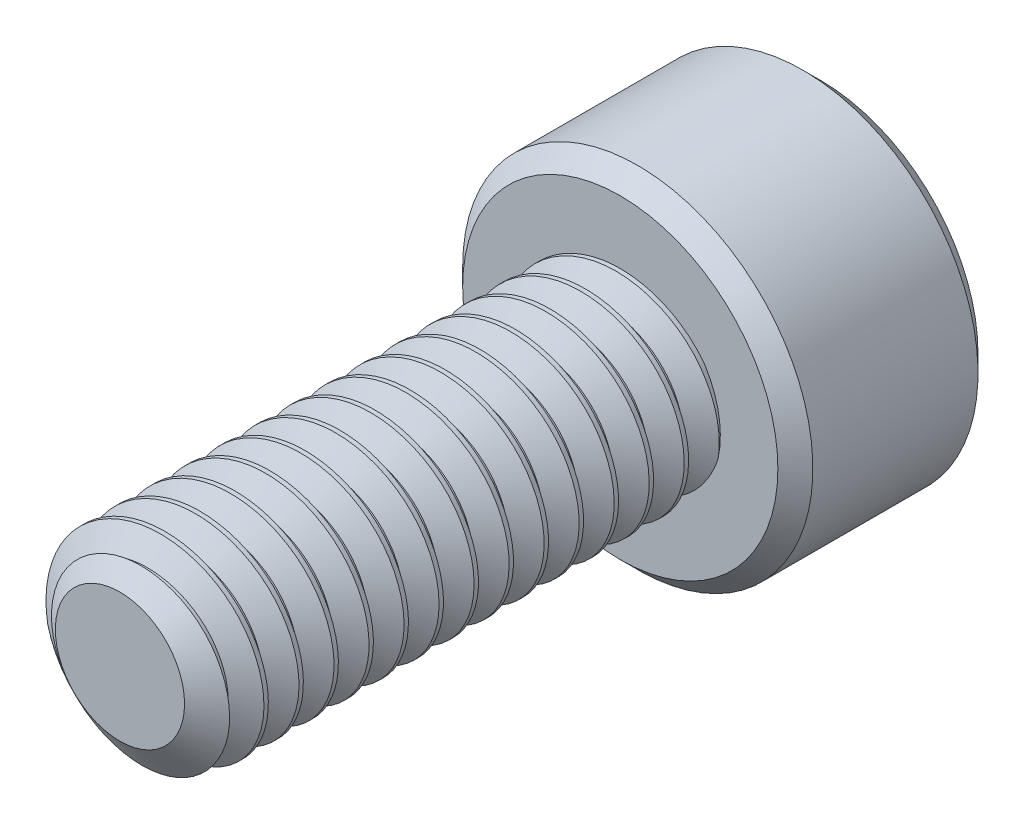
from build123d import *

# Parameters (mm, degrees)
SKETCH1_R          = 2
EXTRUDE1_DEPTH     = 10
CUT_SWEEP1_PITCH   = 0.7
SKETCH6_R          = 3.5
EXTRUDE2_DEPTH     = 4
CUT_EXTRUDE1_DEPTH = 2.25
CHAMFER1_SIZE      = 0.35


with BuildPart() as part:
    # Sketch1 → Extrude1 (new body)
    with BuildSketch(Plane.XY):
        Circle(SKETCH1_R)
    extrude(amount=-EXTRUDE1_DEPTH)

    # Cut-Sweep1: the profile of Sketch3 profile screwed along a right-hand helix of 15.285714 turns, 6 arcs to a turn; built about Z, then put on its axis
    cut_sweep1_z = Axis((0, 0, 0), (0, 0, 1))
    cut_sweep1_corners = [(2.0003, 0, -0.612673205), (1.545336663, 0, -0.35), (1.545336663, 0, -0.2625), (2.0003, 0, 0.000173205)]
    with BuildLine(mode=Mode.PRIVATE) as cut_sweep1_profile:
        Line(cut_sweep1_corners[0], cut_sweep1_corners[1])
        Line(cut_sweep1_corners[1], cut_sweep1_corners[2])
        Line(cut_sweep1_corners[2], cut_sweep1_corners[3])
        Line(cut_sweep1_corners[3], cut_sweep1_corners[0])
    cut_sweep1_cap = Face(cut_sweep1_profile.wire())
    cut_sweep1_turn_angles = [0, 30, 60, 90, 120, 150, 180, 210, 240, 270, 300, 330, 360]
    cut_sweep1_turn_weights = [1, 0.8660254037844387, 1, 0.8660254037844387, 1, 0.8660254037844387, 1, 0.8660254037844387, 1, 0.8660254037844387, 1, 0.8660254037844387, 1]
    cut_sweep1_turn_rails = [Edge.make_bspline([Vector(p[0], p[1], 0).rotate(cut_sweep1_z, cut_sweep1_turn_angles[k]) / cut_sweep1_turn_weights[k] + Vector(0, 0, p[2] + CUT_SWEEP1_PITCH * cut_sweep1_turn_angles[k] / 360) for k in range(13)], [0, 0, 0, 1, 1, 2, 2, 3, 3, 4, 4, 5, 5, 6, 6, 6], 2, cut_sweep1_turn_weights) for p in cut_sweep1_corners]
    cut_sweep1_turn_sides = [Face.make_surface_from_curves(cut_sweep1_turn_rails[p[0]], cut_sweep1_turn_rails[p[1]]) for p in [(0, 1), (1, 2), (2, 3), (3, 0)]]
    cut_sweep1_last_angles = [5400, 5430, 5460, 5481.428571429, 5502.857142857]
    cut_sweep1_last_weights = [1, 0.8660254037844387, 1, 0.9308737486442353, 1]
    cut_sweep1_last_rails = [Edge.make_bspline([Vector(p[0], p[1], 0).rotate(cut_sweep1_z, cut_sweep1_last_angles[k]) / cut_sweep1_last_weights[k] + Vector(0, 0, p[2] + CUT_SWEEP1_PITCH * cut_sweep1_last_angles[k] / 360) for k in range(5)], [0, 0, 0, 1, 1, 2, 2, 2], 2, cut_sweep1_last_weights) for p in cut_sweep1_corners]
    cut_sweep1_last_sides = [Face.make_surface_from_curves(cut_sweep1_last_rails[p[0]], cut_sweep1_last_rails[p[1]]) for p in [(0, 1), (1, 2), (2, 3), (3, 0)]]
    cut_sweep1 = Plane(origin=(0, 0, 0), x_dir=(0, 1, 0), z_dir=(0, 0, -1)) * Solid(Shell([*[p.moved(Location((0, 0, CUT_SWEEP1_PITCH * i))) for i in range(15) for p in cut_sweep1_turn_sides], *cut_sweep1_last_sides, cut_sweep1_cap, cut_sweep1_cap.rotate(cut_sweep1_z, 5502.857142857).moved(Location((0, 0, CUT_SWEEP1_PITCH * 5502.857142857 / 360)))]))
    add(cut_sweep1, mode=Mode.SUBTRACT)

    # Sketch4 → Cut-Revolve1 (revolve, cut)
    with BuildSketch(Plane(origin=(0, 0, 0), x_dir=(0, 0, -1), z_dir=(1, 0, 0)), mode=Mode.PRIVATE) as cut_revolve1_sk:
        Polygon((0.496211411, 2), (0, 1.291336663), (0, 2), align=None)
    revolve(cut_revolve1_sk.sketch.rotate(Axis((0, 0, 0), (0, 0, -1)), 271.401126896), axis=Axis((0, 0, 0), (0, 0, -1)), mode=Mode.SUBTRACT)

    # Sketch6 → Extrude2 (add)
    with BuildSketch(Plane(origin=(0, 0, -10), x_dir=(-1, 0, 0), z_dir=(0, 0, -1))):
        Circle(SKETCH6_R)
    extrude(amount=EXTRUDE2_DEPTH)

    # Sketch7 → Cut-Extrude1 (cut)
    with BuildSketch(Plane(origin=(0, 0, -14), x_dir=(-1, 0, 0), z_dir=(0, 0, -1))):
        Polygon((0, 1.732050808), (-1.5, 0.866025404), (-1.5, -0.866025404), (0, -1.732050808), (1.5, -0.866025404), (1.5, 0.866025404), align=None)
    extrude(amount=-CUT_EXTRUDE1_DEPTH, mode=Mode.SUBTRACT)

    # Cut-Extrude2 cone 1 section (through the dimple's axis) → Cut-Extrude2 (revolve, cut)
    with BuildSketch(Plane(origin=(0, 0, -14), x_dir=(0, 1, 0), z_dir=(1, 0, 0))):
        Polygon((0, 0), (1.732050808, 0), (0, 1.732050808), align=None)
    revolve(axis=Axis((0, 0, -14), (0, 0, 1)), mode=Mode.SUBTRACT)

    # Chamfer1
    chamfer1_edges = [part.edges().sort_by_distance(p)[0] for p in [
        (3.5, 0, -10),
        (3.5, 0, -14),
    ]]
    chamfer(chamfer1_edges, length=CHAMFER1_SIZE)


solid = part.part
